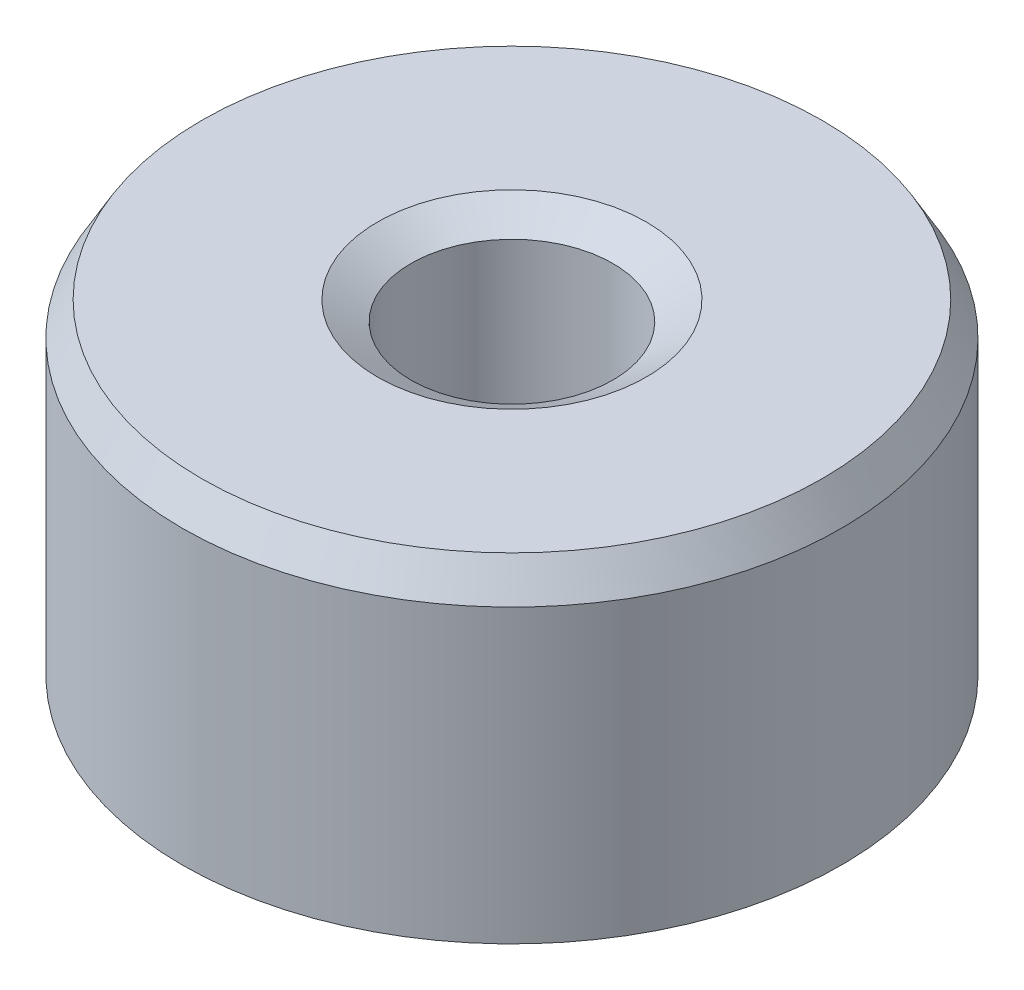
from build123d import *
from OCP.BRepFilletAPI import BRepFilletAPI_MakeChamfer

# Parameters (mm, degrees)
SKETCH1_R           = 7.5
BOSS_EXTRUDE1_DEPTH = 7.835206929
SKETCH2_R           = 2.299304833
CUT_EXTRUDE1_DEPTH  = 14.18675349
CHAMFER1_SIZE       = 0.759244358
CHAMFER1_SIZE2      = 0.438349934


with BuildPart() as part:
    # Sketch1 → Boss-Extrude1 (new body)
    with BuildSketch(Plane(origin=(0, 0, 0), x_dir=(1, 0, 0), z_dir=(0, 1, 0))):
        Circle(SKETCH1_R)
    extrude(amount=BOSS_EXTRUDE1_DEPTH)

    # Sketch2 → Cut-Extrude1 (cut, through all)
    with BuildSketch(Plane(origin=(0, 0, 0), x_dir=(1, 0, 0), z_dir=(0, 1, 0))):
        Circle(SKETCH2_R)
    extrude(amount=CUT_EXTRUDE1_DEPTH, mode=Mode.SUBTRACT)

    # Chamfer1: one chamfer whose edges measure the first distance from different faces: ONE call of the kernel's chamfer builder (chamfer() names one face for all edges)
    chamfer1_edges_1 = [part.edges().sort_by_distance(p)[0] for p in [
        (-2.299304833, 7.835206929, 0),
    ]]
    chamfer1_side_1 = [part.faces().sort_by_distance(p)[0] for p in [
        (-7.287867966, 7.835206929, 0),
    ]]
    chamfer1_edges_2 = [part.edges().sort_by_distance(p)[0] for p in [
        (-2.299304833, 0, 0),
    ]]
    chamfer1_side_2 = [part.faces().sort_by_distance(p)[0] for p in [
        (-2.299304833, 3.917603464, 0),
    ]]
    chamfer1_edges_3 = [part.edges().sort_by_distance(p)[0] for p in [
        (-7.5, 0, 0),
    ]]
    chamfer1_side_3 = [part.faces().sort_by_distance(p)[0] for p in [
        (-7.287867966, 0, 0),
    ]]
    chamfer1_edges_4 = [part.edges().sort_by_distance(p)[0] for p in [
        (-7.5, 7.835206929, 0),
    ]]
    chamfer1_side_4 = [part.faces().sort_by_distance(p)[0] for p in [
        (-7.5, 3.917603464, 0),
    ]]
    chamfer1 = BRepFilletAPI_MakeChamfer(part.part.solid().wrapped)
    for e in chamfer1_edges_1:
        chamfer1.Add(CHAMFER1_SIZE, CHAMFER1_SIZE2, e.wrapped, chamfer1_side_1[0].wrapped)  # the first distance lies on this face
    for e in chamfer1_edges_2:
        chamfer1.Add(CHAMFER1_SIZE, CHAMFER1_SIZE2, e.wrapped, chamfer1_side_2[0].wrapped)  # the first distance lies on this face
    for e in chamfer1_edges_3:
        chamfer1.Add(CHAMFER1_SIZE, CHAMFER1_SIZE2, e.wrapped, chamfer1_side_3[0].wrapped)  # the first distance lies on this face
    for e in chamfer1_edges_4:
        chamfer1.Add(CHAMFER1_SIZE, CHAMFER1_SIZE2, e.wrapped, chamfer1_side_4[0].wrapped)  # the first distance lies on this face
    add(Compound.cast(chamfer1.Shape()), mode=Mode.REPLACE)


solid = part.part
